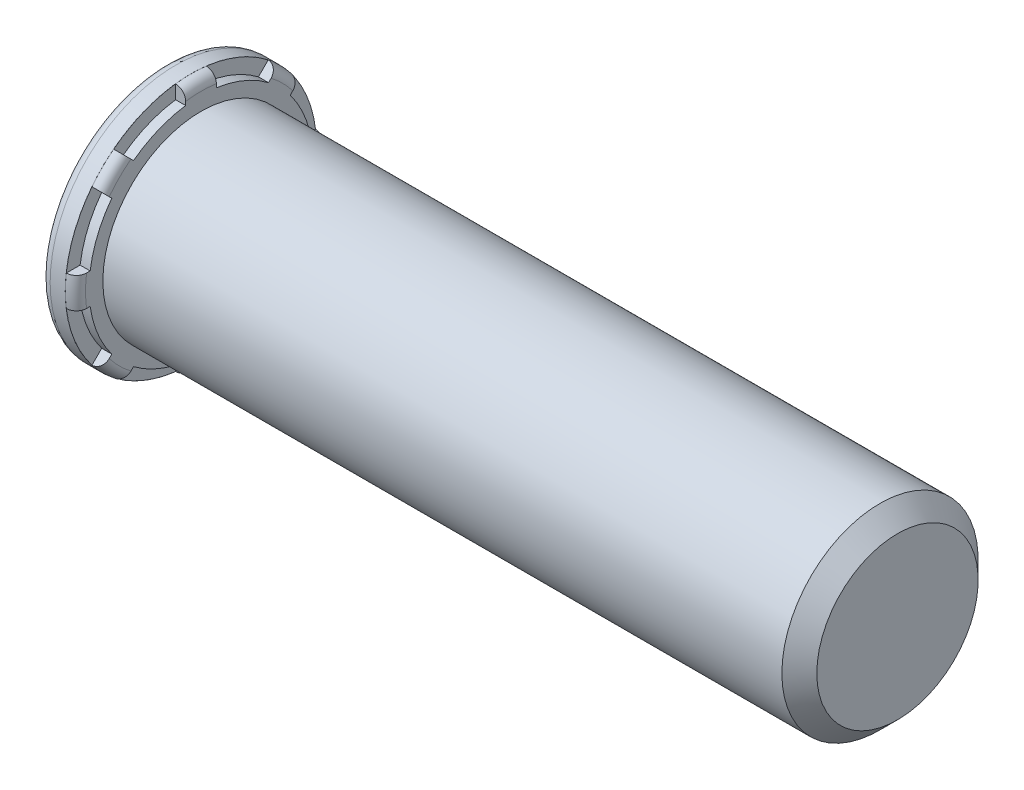
from build123d import *

# Parameters (mm, degrees)
RIBCUT_START     = -0.2561
RIBCUT_DEPTH     = 0.2561
RIBCUTSPAT_COUNT = 8
RIBCUTSPAT_ANGLE = 315


with BuildPart() as part:
    # BodySke → BaseBody (revolve)
    with BuildSketch(Plane.XY):
        with BuildLine():
            Line((-0.64, 2.944), (-0.64, 0))
            Line((-0.64, 0), (18, 0))
            Line((18, 0), (18, 2.055))
            Line((18, 2.055), (17.555, 2.5))
            Line((17.555, 2.5), (0.25854, 2.5))
            Line((0.25854, 2.5), (0.25854, 2.94146))
            ThreePointArc((0.25854, 2.94146), (0.183559336, 3.122479336), (0.00254, 3.19746))
            Line((0.00254, 3.19746), (0, 3.19746))
            Line((0, 3.19746), (0, 3.2))
            Line((0, 3.2), (-0.384, 3.2))
            ThreePointArc((-0.384, 3.2), (-0.565019336, 3.125019336), (-0.64, 2.944))
        make_face()
    revolve(axis=Axis((0, 0, 0), (1, 0, 0)))

    # RibCutSke → RibCut (cut)
    with BuildSketch(Plane(origin=(0.25854, 1.794401132, -0.090952894), x_dir=(0, 0, -1), z_dir=(1, 0, 0)).offset(RIBCUT_START)):
        with BuildLine():
            Line((0.300133268, 1.028638296), (0.300133268, 1.381610771))
            ThreePointArc((0.300133268, 1.381610771), (1.133634089, 1.162013372), (1.878286983, 0.7279181))
            Line((1.878286983, 0.7279181), (1.628697752, 0.478328869))
            ThreePointArc((1.628697752, 0.478328869), (0.999694888, 0.838655535), (0.300133268, 1.028638296))
        make_face()
    ribcut = extrude(amount=RIBCUT_DEPTH, mode=Mode.SUBTRACT)

    # RibCutsPat: RibCut ×8 about axis
    ribcutspat_axis = Axis((0, 0, 0), (1, 0, 0))
    for i in range(1, RIBCUTSPAT_COUNT):
        add(ribcut.rotate(ribcutspat_axis, i * RIBCUTSPAT_ANGLE / (RIBCUTSPAT_COUNT - 1)), mode=Mode.SUBTRACT)


solid = part.part
